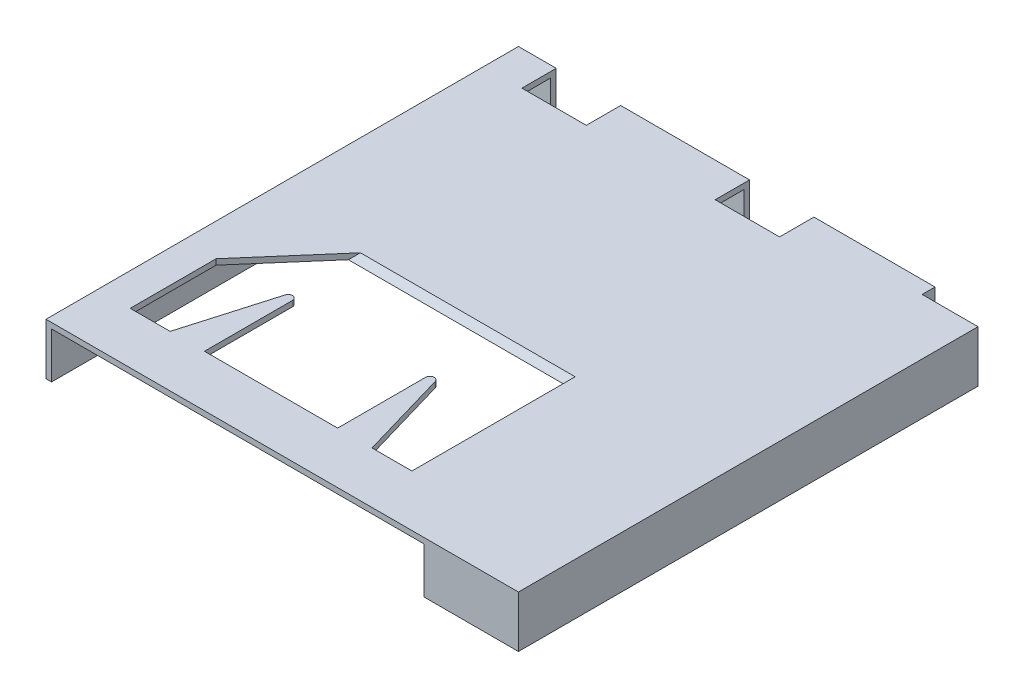
from build123d import *

# Parameters (mm, degrees)
SKETCH1_W           = 5.2324
SKETCH1_H           = 13.97
BOSS_EXTRUDE1_DEPTH = 1.524
BOSS_EXTRUDE2_DEPTH = 12.954
SKETCH3_W           = 1.1176
SKETCH3_H           = 1.524
BOSS_EXTRUDE3_DEPTH = 1.016
SKETCH4_W           = 3.81
SKETCH4_H           = 0.1651
BOSS_EXTRUDE4_DEPTH = 1.016
SKETCH5_W           = 3.81
SKETCH5_H           = 0.1651
BOSS_EXTRUDE5_DEPTH = 1.3589
SKETCH6_W           = 13.8049
SKETCH6_H           = 1.3589
CUT_EXTRUDE1_DEPTH  = 0.9525
SKETCH7_W           = 13.8049
SKETCH7_H           = 1.3589
CUT_EXTRUDE2_DEPTH  = 2.4384
SKETCH8_W           = 1.651
SKETCH8_H           = 0.381
CUT_EXTRUDE3_DEPTH  = 1.524
CUT_EXTRUDE4_DEPTH  = 10.995150124
CHAMFER1_SIZE       = 1.143
CHAMFER1_SIZE2      = 0.9906
CHAMFER2_SIZE       = 1.143
CHAMFER2_SIZE_2     = 0.9906


with BuildPart() as part:
    # Sketch1 → Boss-Extrude1 (new body)
    with BuildSketch(Plane(origin=(0, 1.524, 0), x_dir=(-1, 0, 0), z_dir=(0, 1, 0))):
        with Locations((-4.3688, 0)):
            Rectangle(SKETCH1_W, SKETCH1_H)
    extrude(amount=-BOSS_EXTRUDE1_DEPTH)

    # Sketch2 → Boss-Extrude2 (add)
    with BuildSketch(Plane.XY.offset(6.985)):
        Polygon((-5.8674, 1.3589), (1.7526, 1.3589), (1.7526, 1.524), (-6.985, 1.524), (-6.985, 0), (-5.8674, 0), align=None)
    extrude(amount=-BOSS_EXTRUDE2_DEPTH)

    # Sketch3 → Boss-Extrude3 (add)
    with BuildSketch(Plane(origin=(0, 0, -5.969), x_dir=(-1, 0, 0), z_dir=(0, 0, -1))):
        with Locations((6.4262, 0.762)):
            Rectangle(SKETCH3_W, SKETCH3_H)
    extrude(amount=BOSS_EXTRUDE3_DEPTH)

    # Sketch4 → Boss-Extrude4 (add)
    with BuildSketch(Plane(origin=(0, 0, -5.969), x_dir=(-1, 0, 0), z_dir=(0, 0, -1))):
        with Locations((2.0574, 1.44145)):
            Rectangle(SKETCH4_W, SKETCH4_H)
    extrude(amount=BOSS_EXTRUDE4_DEPTH)

    # Sketch5 → Boss-Extrude5 (add)
    with BuildSketch(Plane.XZ.offset(-1.3589)):
        with Locations((-2.0574, -6.90245)):
            Rectangle(SKETCH5_W, SKETCH5_H)
    extrude(amount=BOSS_EXTRUDE5_DEPTH)

    # Sketch6 → Cut-Extrude1 (cut)
    with BuildSketch(Plane(origin=(-5.8674, 0, 0), x_dir=(0, 0, -1), z_dir=(1, 0, 0))):
        with Locations((-0.08255, 0.67945)):
            Rectangle(SKETCH6_W, SKETCH6_H)
    extrude(amount=-CUT_EXTRUDE1_DEPTH, mode=Mode.SUBTRACT)

    # Sketch7 → Cut-Extrude2 (cut)
    with BuildSketch(Plane.ZY.offset(-1.7526)):
        with Locations((0.08255, 0.67945)):
            Rectangle(SKETCH7_W, SKETCH7_H)
    extrude(amount=-CUT_EXTRUDE2_DEPTH, mode=Mode.SUBTRACT)

    # Sketch8 → Cut-Extrude3 (cut)
    with BuildSketch(Plane(origin=(0, 1.524, 0), x_dir=(-1, 0, 0), z_dir=(0, 1, 0))):
        with Locations((-6.1595, -6.7945)):
            Rectangle(SKETCH8_W, SKETCH8_H)
    extrude(amount=-CUT_EXTRUDE3_DEPTH, mode=Mode.SUBTRACT)

    # Sketch9 → Cut-Extrude4 (cut, through all)
    with BuildSketch(Plane(origin=(0, 1.524, 0), x_dir=(-1, 0, 0), z_dir=(0, 1, 0))):
        with BuildLine():
            Line((3.8227, 2.860968655), (3.8227, 5.461))
            Line((3.8227, 5.461), (-0.1143, 5.461))
            Line((-0.1143, 5.461), (-0.1143, 2.860968655))
            ThreePointArc((-0.1143, 2.860968655), (-0.223375415, 2.735239942), (-0.363240303, 2.825478341))
            Line((-0.363240303, 2.825478341), (-1.1303, 5.461))
            Line((-1.1303, 5.461), (-2.3114, 5.461))
            Line((-2.3114, 5.461), (-2.3114, 1.778))
            Line((-2.3114, 1.778), (6.0198, 1.778))
            Line((6.0198, 1.778), (6.0198, 5.461))
            Line((6.0198, 5.461), (4.8387, 5.461))
            Line((4.8387, 5.461), (4.071640303, 2.825478341))
            ThreePointArc((4.071640303, 2.825478341), (3.931775415, 2.735239942), (3.8227, 2.860968655))
        make_face()
    extrude(amount=-CUT_EXTRUDE4_DEPTH, mode=Mode.SUBTRACT)

    # Chamfer1
    chamfer1_edges = [part.edges().sort_by_distance(p)[0] for p in [
        (-6.0198, 1.44145, 1.778),
    ]]
    chamfer1_side = [part.faces().sort_by_distance(p)[0] for p in [
        (-6.0198, 1.44145, 3.6195),
    ]]
    chamfer(chamfer1_edges, length=CHAMFER1_SIZE, length2=CHAMFER1_SIZE2, reference=chamfer1_side[0])

    # Chamfer2
    # the kernel refuses this chamfer: 1.143, 0.9906 mm, written as the material it takes off along each edge
    with BuildSketch(Plane(origin=(2.3114, 1.524, 1.778), x_dir=(0, 0.025420360363461764, -0.9996768504266725), z_dir=(-1, 0, 0))) as chamfer2_piece_1_section:
        Polygon((CHAMFER2_SIZE * 0.999676850427, CHAMFER2_SIZE * 0.0254203603635), (-CHAMFER2_SIZE_2 * 0.0254203603635, CHAMFER2_SIZE_2 * 0.999676850427), (0, 0), align=None)
    chamfer2_piece_1 = extrude(amount=10.285426882, mode=Mode.PRIVATE)
    chamfer2_piece_1 = split(chamfer2_piece_1, bisect_by=Plane(origin=(-3.105218089, 1.443787017, -0.441979128), z_dir=(0.7556890827898172, 0, 0.6549305384178423)), keep=Keep.TOP, mode=Mode.PRIVATE)
    add(chamfer2_piece_1, mode=Mode.SUBTRACT)


solid = part.part
